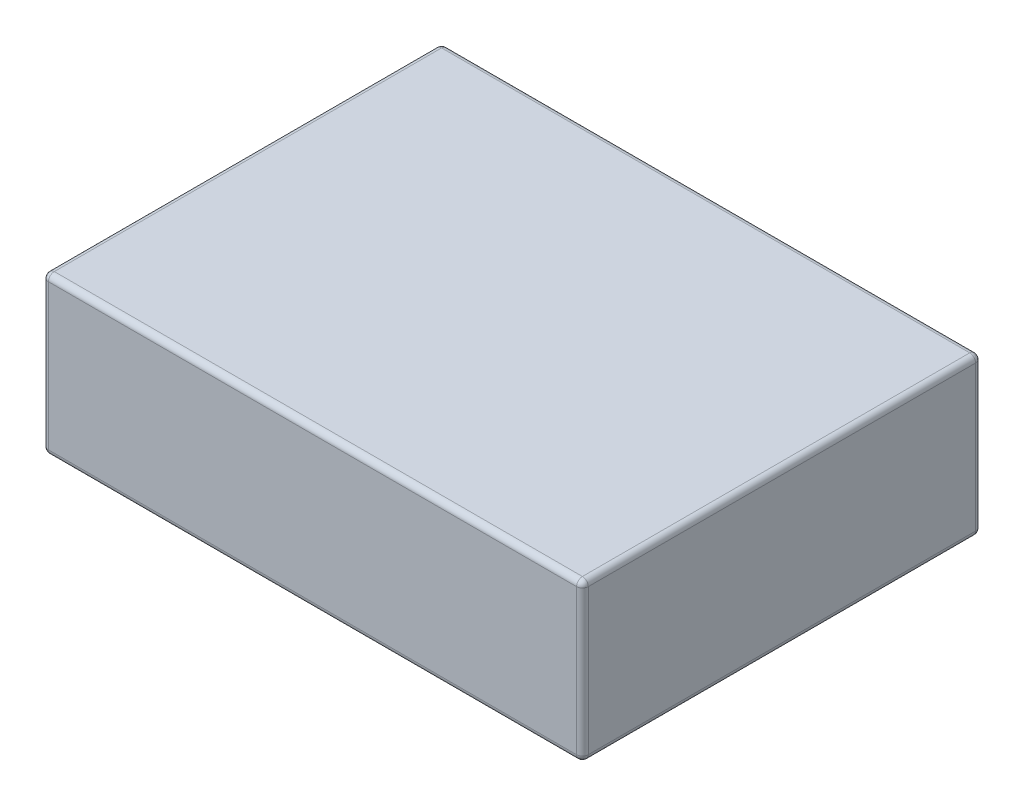
from build123d import *

# Parameters (mm, degrees)
SKETCH1_W           = 23
SKETCH1_H           = 17
BOSS_EXTRUDE1_DEPTH = 6.7
FILLET1_R           = 0.25


with BuildPart() as part:
    # Sketch1 → Boss-Extrude1 (new body)
    with BuildSketch(Plane(origin=(0, 0, 0), x_dir=(1, 0, 0), z_dir=(0, 1, 0))):
        with Locations((11.5, 8.5)):
            Rectangle(SKETCH1_W, SKETCH1_H)
    extrude(amount=BOSS_EXTRUDE1_DEPTH)

    # Fillet1
    fillet1_edges = [part.edges().sort_by_distance(p)[0] for p in [
        (0, 0, -8.5),
        (0, 3.35, -17),
        (11.5, 0, -17),
        (23, 3.35, -17),
        (23, 0, -8.5),
        (23, 3.35, 0),
        (11.5, 0, 0),
        (0, 3.35, 0),
        (0, 6.7, -8.5),
        (11.5, 6.7, -17),
        (23, 6.7, -8.5),
        (11.5, 6.7, 0),
    ]]
    fillet(fillet1_edges, radius=FILLET1_R)


solid = part.part
